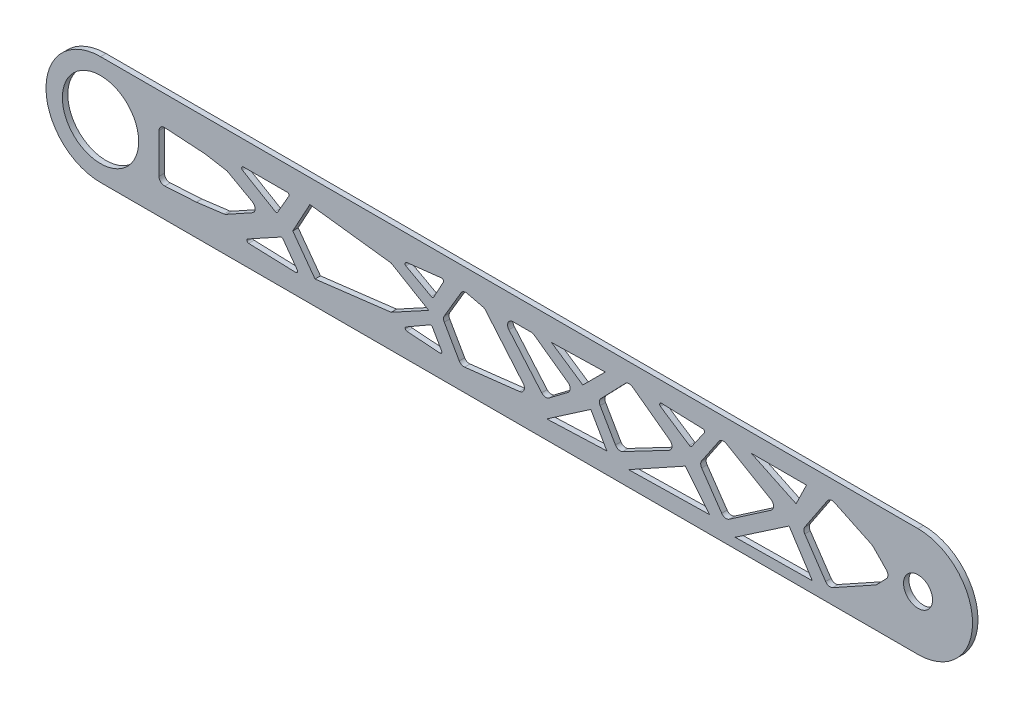
from build123d import *

# Parameters (mm, degrees)
SKETCH1_R           = 21
BOSS_EXTRUDE1_DEPTH = 3
SKETCH2_R           = 8
CUT_EXTRUDE1_DEPTH  = 10
CUT_EXTRUDE2_DEPTH  = 10
FILLET1_R           = 3
FILLET2_R           = 1
FILLET3_R           = 3


with BuildPart() as part:
    # Sketch1 → Boss-Extrude1 (new body)
    with BuildSketch(Plane.XY):
        with BuildLine():
            Line((0, 30), (450, 30))
            ThreePointArc((450, 30), (480, 0), (450, -30))
            Line((450, -30), (0, -30))
            ThreePointArc((0, -30), (-30, 0), (0, 30))
        make_face()
        Circle(SKETCH1_R, mode=Mode.SUBTRACT)
    extrude(amount=BOSS_EXTRUDE1_DEPTH)

    # Sketch2 → Cut-Extrude1 (cut)
    with BuildSketch(Plane(origin=(0, 0, 0), x_dir=(-1, 0, 0), z_dir=(0, 0, -1))):
        with Locations((-450, 0)):
            Circle(SKETCH2_R)
    extrude(amount=-CUT_EXTRUDE1_DEPTH, mode=Mode.SUBTRACT)

    # Sketch4 → Cut-Extrude2 (cut)
    with BuildSketch(Plane.XY.offset(3)):
        Polygon((75.051155, 16.751903708), (104.496414244, 16.751903708), (97.010331386, 3.776026753), align=None)
        Polygon((115.236434087, 17.133628969), (159.994947493, 11.590143364), (180.655213039, -0.618195368), (159.994947493, -11.858002091), (118.085145684, -16.966802955), (105.823337098, -0.177570288), align=None)
        Polygon((189.665526052, 18.578346929), (182.941129647, 6.211814834), (165.368544986, 15.767042135), align=None)
        Polygon((199.599828734, 18.578346929), (188.361345274, -0.440625079), (198.44447832, -18.021795356), (236.21688029, -13.651304452), (211.35817569, 15.767042135), align=None)
        Polygon((220.526900823, 17.172694532), (237.960392272, 17.172694532), (260.559362669, 1.057868841), (244.675514904, -10.943884315), align=None)
        Polygon((265.46656767, 6.211814834), (277.833099766, 18.578346929), (248.220353812, 17.874878196), align=None)
        Polygon((165.368544986, -16.358724589), (182.200526719, -6.705265316), (188.690770328, -18.021795356), align=None)
        Polygon((245.637394842, -19.868271823), (269.887796501, -3.220439984), (278.716640894, -18.61460526), align=None)
        Polygon((290.68321902, -21.539751298), (321.940631216, -4.211371592), (335.206376445, -20.70401156), align=None)
        Polygon((341.992933025, 19.183441398), (329.735187473, 1.057868841), (343.614563911, -19.159806148), (373.065049946, 1.057868841), align=None)
        Polygon((273.877820417, 3.11420529), (290.68321902, 20.542728609), (317.209913689, 1.057868841), (284.881711611, -15.886302486), align=None)
        Polygon((305.30736893, 19.270974689), (333.375882047, 18.324324896), (324.94206251, 6.211814834), align=None)
        Polygon((358.198045962, 20.050204211), (388.597492455, 20.050204211), (382.886534474, 8.292807575), align=None)
        Polygon((349.331047186, -24.428108969), (379.030224427, -4.211371592), (391.830023208, -23.92704923), align=None)
        Polygon((386.543005003, -2.048490112), (401.586425759, 20.569577221), (424.881274354, 9.475873595), (434.601030173, -0.440625079), (426.98326683, -8.340846264), (400.664497987, -22.912566492), align=None)
        Polygon((77.908222084, -18.113128875), (99.959146412, -5.986003719), (109.517710051, -19.216558315), align=None)
        Polygon((32.181427401, 14.045195837), (32.181427401, -14.186471438), (52.8225456, -12.955618238), (68.554424875, -10.943884315), (88.302954178, 0), (69.662476286, 10.346921974), (57.571708379, 12.423629667), align=None)
    extrude(amount=-CUT_EXTRUDE2_DEPTH, mode=Mode.SUBTRACT)

    # Fillet1
    # the kernel refuses this fillet: 3 mm, written as the material it adds along each edge
    with BuildSketch(Plane(origin=(32.181427401, 14.045195837, 3), x_dir=(0, -1, 0), z_dir=(0, 0, -1))) as fillet1_piece_1:
        with BuildLine():
            CenterArc((FILLET1_R * 1.06590295895, -FILLET1_R), FILLET1_R, 90, 93.654267812)
            Line((FILLET1_R * 0.0679361503378, -FILLET1_R * 1.06373577423), (0, 0))
            Line((0, 0), (FILLET1_R * 1.06590295895, 0))
        make_face()
    extrude(amount=3)
    with BuildSketch(Plane(origin=(57.571708379, 12.423629667, 3), x_dir=(-0.9979668086083109, 0.06373577422564991, 0), z_dir=(0, 0, -1))) as fillet1_piece_2:
        with BuildLine():
            CenterArc((FILLET1_R * 0.0532106389046, -FILLET1_R), FILLET1_R, 90, 6.091745071)
            Line((-FILLET1_R * 0.0529101714038, -FILLET1_R * 0.00564675611758), (0, 0))
            Line((0, 0), (FILLET1_R * 0.0532106389046, 0))
        make_face()
    extrude(amount=3)
    with BuildSketch(Plane(origin=(69.662476286, 10.346921974, 3), x_dir=(-0.9855678414202016, 0.16928092024302194, 0), z_dir=(0, 0, -1))) as fillet1_piece_3:
        with BuildLine():
            CenterArc((FILLET1_R * 0.169924527084, -FILLET1_R), FILLET1_R, 90, 19.287684891)
            Line((-FILLET1_R * 0.160386998178, -FILLET1_R * 0.0561280297205), (0, 0))
            Line((0, 0), (FILLET1_R * 0.169924527084, 0))
        make_face()
    extrude(amount=3)
    with BuildSketch(Plane(origin=(88.302954178, 0, 3), x_dir=(-0.8743344213622383, 0.48532393266885154, 0), z_dir=(0, 0, -1))) as fillet1_piece_4:
        with BuildLine():
            CenterArc((FILLET1_R * 1.80303637433, -FILLET1_R), FILLET1_R, 90, 121.972748141)
            Line((FILLET1_R * 0.954736326134, -FILLET1_R * 1.52951584323), (0, 0))
            Line((0, 0), (FILLET1_R * 1.80303637433, 0))
        make_face()
    extrude(amount=3)
    with BuildSketch(Plane(origin=(68.554424875, -10.943884315, 3), x_dir=(0.8746742438686059, 0.4847112203290558, 0), z_dir=(0, 0, -1))) as fillet1_piece_5:
        with BuildLine():
            CenterArc((FILLET1_R * 0.191722072286, -FILLET1_R), FILLET1_R, 90, 21.70633324)
            Line((-FILLET1_R * 0.178127385219, -FILLET1_R * 0.0709083044269), (0, 0))
            Line((0, 0), (FILLET1_R * 0.191722072286, 0))
        make_face()
    extrude(amount=3)
    with BuildSketch(Plane(origin=(52.8225456, -12.955618238, 3), x_dir=(0.9919227581955331, 0.1268433749699441, 0), z_dir=(0, 0, -1))) as fillet1_piece_6:
        with BuildLine():
            CenterArc((FILLET1_R * 0.0338255904119, -FILLET1_R), FILLET1_R, 90, 3.874649837)
            Line((-FILLET1_R * 0.0337482743847, -FILLET1_R * 0.00228572587316), (0, 0))
            Line((0, 0), (FILLET1_R * 0.0338255904119, 0))
        make_face()
    extrude(amount=3)
    with BuildSketch(Plane(origin=(32.181427401, -14.186471438, 3), x_dir=(0, 1, 0), z_dir=(0, 0, -1))) as fillet1_piece_7:
        with BuildLine():
            CenterArc((FILLET1_R * 1.06140748795, FILLET1_R), FILLET1_R, 176.587428992, 93.412571008)
            Line((FILLET1_R * 0.0631806961919, FILLET1_R * 1.05952539143), (0, 0))
            Line((0, 0), (FILLET1_R * 1.06140748795, 0))
        make_face()
    extrude(amount=3)

    # Fillet2
    fillet2_edges = [part.edges().sort_by_distance(p)[0] for p in [
        (188.690770328, -18.021795356, 1.5),
        (165.368544986, -16.358724589, 1.5),
        (182.200526719, -6.705265316, 1.5),
        (97.010331386, 3.776026753, 1.5),
        (75.051155, 16.751903708, 1.5),
        (104.496414244, 16.751903708, 1.5),
        (165.368544986, 15.767042135, 1.5),
        (189.665526052, 18.578346929, 1.5),
        (182.941129647, 6.211814834, 1.5),
        (109.517710051, -19.216558315, 1.5),
        (77.908222084, -18.113128875, 1.5),
        (99.959146412, -5.986003719, 1.5),
        (324.94206251, 6.211814834, 1.5),
        (305.30736893, 19.270974689, 1.5),
        (333.375882047, 18.324324896, 1.5),
    ]]
    fillet(fillet2_edges, radius=FILLET2_R)

    # Fillet3
    fillet3_edges = [part.edges().sort_by_distance(p)[0] for p in [
        (199.599828734, 18.578346929, 1.5),
        (211.35817569, 15.767042135, 1.5),
        (236.21688029, -13.651304452, 1.5),
        (198.44447832, -18.021795356, 1.5),
        (188.361345274, -0.440625079, 1.5),
        (400.664497987, -22.912566492, 1.5),
        (386.543005003, -2.048490112, 1.5),
        (401.586425759, 20.569577221, 1.5),
        (424.881274354, 9.475873595, 1.5),
        (434.601030173, -0.440625079, 1.5),
        (426.98326683, -8.340846264, 1.5),
        (341.992933025, 19.183441398, 1.5),
        (373.065049946, 1.057868841, 1.5),
        (343.614563911, -19.159806148, 1.5),
        (329.735187473, 1.057868841, 1.5),
        (284.881711611, -15.886302486, 1.5),
        (273.877820417, 3.11420529, 1.5),
        (290.68321902, 20.542728609, 1.5),
        (317.209913689, 1.057868841, 1.5),
        (244.675514904, -10.943884315, 1.5),
        (220.526900823, 17.172694532, 1.5),
        (237.960392272, 17.172694532, 1.5),
        (260.559362669, 1.057868841, 1.5),
    ]]
    fillet(fillet3_edges, radius=FILLET3_R)


solid = part.part
